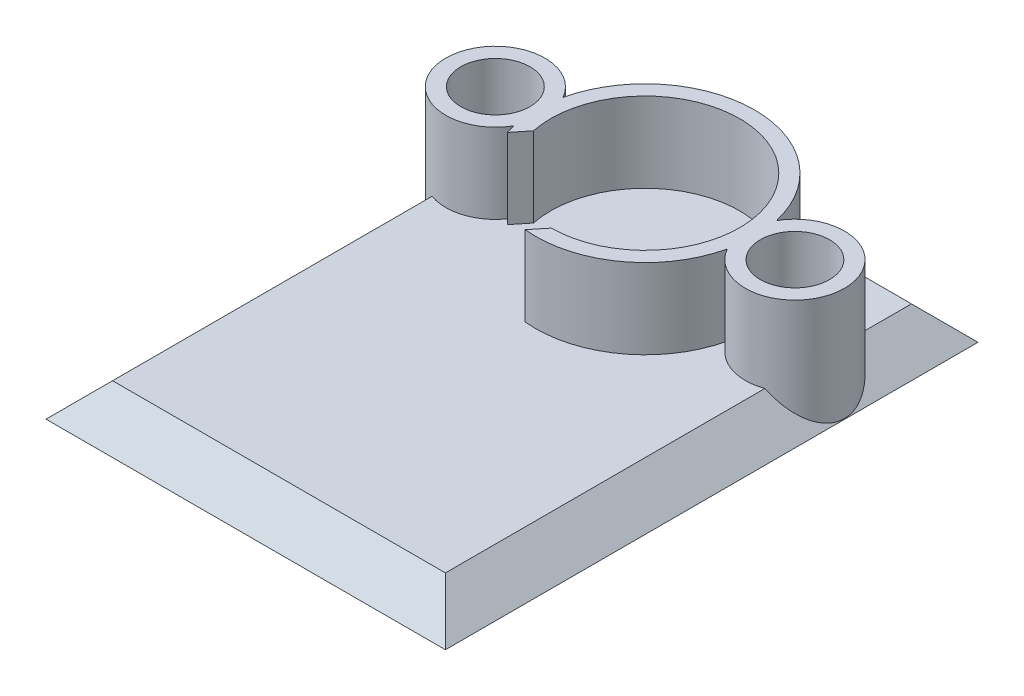
from build123d import *

# Parameters (mm, degrees)
SKETCH1_W           = 60
SKETCH1_H           = 80
BOSS_EXTRUDE2_DEPTH = 5
SKETCH1_7_R         = 5.2
BOSS_EXTRUDE4_DEPTH = 12
CHAMFER1_SIZE       = 5


with BuildPart() as part:
    # Sketch1 → Boss-Extrude2 (new body)
    with BuildSketch(Plane(origin=(0, 0, 0), x_dir=(1, 0, 0), z_dir=(0, 1, 0))):
        Rectangle(SKETCH1_W, SKETCH1_H)
    extrude(amount=-BOSS_EXTRUDE2_DEPTH)

    # Sketch1<7> → Boss-Extrude4 (add)
    with BuildSketch(Plane(origin=(0, 0, 0), x_dir=(1, 0, 0), z_dir=(0, 1, 0))):
        with BuildLine():
            Line((-15.656226575, 14.951726095), (-13.904483467, 17.118101406))
            ThreePointArc((-13.904483467, 17.118101406), (8.928488267, 31.041833963), (0.092207471, 5.800299377))
            Line((0.092207471, 5.800299377), (-1.659535637, 3.633924066))
            ThreePointArc((-1.659535637, 3.633924066), (9.580000014, 6.627412377), (16.03, 16.306546332))
            ThreePointArc((16.03, 16.306546332), (29.95, 20), (16.03, 23.693453668))
            ThreePointArc((16.03, 23.693453668), (0, 36.45), (-16.03, 23.693453668))
            ThreePointArc((-16.03, 23.693453668), (-29.95, 20), (-16.03, 16.306546332))
            ThreePointArc((-16.03, 16.306546332), (-15.857588818, 15.625142644), (-15.656226575, 14.951726095))
        make_face()
        with Locations(Location((-22.5, 20, 0), (0, 0, 270))):
            Circle(SKETCH1_7_R, mode=Mode.SUBTRACT)
        with Locations(Location((22.5, 20, 0), (0, 0, 270))):
            Circle(SKETCH1_7_R, mode=Mode.SUBTRACT)
    extrude(amount=BOSS_EXTRUDE4_DEPTH)

    # Chamfer1
    # the kernel refuses this chamfer: 5 mm, written as the material it takes off along each edge
    with BuildSketch(Plane(origin=(42.85841494, 0, -40), x_dir=(0, 0.027495876610586372, 0.9996219169112968), z_dir=(-1, 0, 0))) as chamfer1_piece_1_section:
        Polygon((CHAMFER1_SIZE * 0.999621916911, -CHAMFER1_SIZE * 0.0274958766106), (-CHAMFER1_SIZE * 0.0274958766106, -CHAMFER1_SIZE * 0.999621916911), (0, 0), align=None)
    chamfer1_piece_1 = extrude(amount=85.71682988, mode=Mode.PRIVATE)
    chamfer1_piece_1 = chamfer1_piece_1 - Plane(origin=(0, -1.679599763, -20), x_dir=(0.9744680851063817, 0, -0.22452605886422566), z_dir=(0, -1, 0)) * Cylinder(16.45, 192, mode=Mode.PRIVATE)
    add(chamfer1_piece_1, mode=Mode.SUBTRACT)
    with BuildSketch(Plane(origin=(30, 0, 52.85841494), x_dir=(0.027495876610586317, -0.9996219169112968, 0), z_dir=(0, 0, -1))) as chamfer1_piece_2_section:
        Polygon((CHAMFER1_SIZE * 0.999621916911, CHAMFER1_SIZE * 0.0274958766106), (-CHAMFER1_SIZE * 0.0274958766106, CHAMFER1_SIZE * 0.999621916911), (0, 0), align=None)
    chamfer1_piece_2 = extrude(amount=105.71682988, mode=Mode.PRIVATE)
    chamfer1_piece_2 = chamfer1_piece_2 - Plane(origin=(22.5, -1.692858266, -20), x_dir=(-0.8684563758389187, 0, 0.49576559306261964), z_dir=(0, -1, 0)) * Cylinder(7.45, 232, mode=Mode.PRIVATE)
    add(chamfer1_piece_2, mode=Mode.SUBTRACT)
    with BuildSketch(Plane(origin=(-42.85841494, 0, 40), x_dir=(0, -0.9996219169112968, 0.027495876610586317), z_dir=(1, 0, 0))) as chamfer1_piece_3:
        Polygon((CHAMFER1_SIZE * 0.999621916911, CHAMFER1_SIZE * 0.0274958766106), (-CHAMFER1_SIZE * 0.0274958766106, CHAMFER1_SIZE * 0.999621916911), (0, 0), align=None)
    extrude(amount=85.71682988, mode=Mode.SUBTRACT)
    with BuildSketch(Plane(origin=(-30, 0, -52.85841494), x_dir=(-0.027495876610586317, -0.9996219169112968, 0), z_dir=(0, 0, 1))) as chamfer1_piece_4_section:
        Polygon((CHAMFER1_SIZE * 0.999621916911, CHAMFER1_SIZE * 0.0274958766106), (-CHAMFER1_SIZE * 0.0274958766106, CHAMFER1_SIZE * 0.999621916911), (0, 0), align=None)
    chamfer1_piece_4 = extrude(amount=105.71682988, mode=Mode.PRIVATE)
    chamfer1_piece_4 = chamfer1_piece_4 - Plane(origin=(-22.5, -1.692858266, -20), x_dir=(0.8684563758389191, 0, -0.4957655930626189), z_dir=(0, -1, 0)) * Cylinder(7.45, 232, mode=Mode.PRIVATE)
    add(chamfer1_piece_4, mode=Mode.SUBTRACT)


solid = part.part
